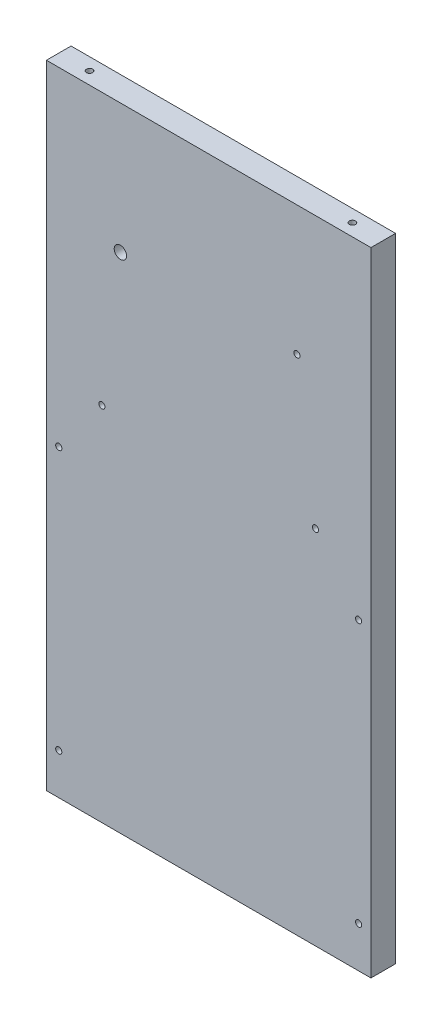
from build123d import *
from OCP.BRepAlgoAPI import BRepAlgoAPI_Cut
from OCP.TopTools import TopTools_ListOfShape

# Parameters (mm, degrees)
SKETCH1_W           = 158
SKETCH1_H           = 308
SKETCH1_R           = 1.5
SKETCH1_R_2         = 3
BOSS_EXTRUDE1_DEPTH = 12
SKETCH5_R           = 3
CUT_EXTRUDE4_DEPTH  = 3
CUT_EXTRUDE4_TAPER  = 45
CUT_EXTRUDE5_START  = 103.536585
SKETCH6_R           = 1.5
CUT_EXTRUDE5_DEPTH  = 20


with BuildPart() as part:
    # Sketch1 → Boss-Extrude1 (new body)
    with BuildSketch(Plane.XY):
        with Locations((-77.951219512, -50.463414634)):
            Rectangle(SKETCH1_W, SKETCH1_H)
        with Locations((-129.951219512, -28.463414634)):
            Circle(SKETCH1_R, mode=Mode.SUBTRACT)
        with Locations((-25.951219512, -28.463414634)):
            Circle(SKETCH1_R, mode=Mode.SUBTRACT)
        with Locations((-34.951219512, 40.536585366)):
            Circle(SKETCH1_R, mode=Mode.SUBTRACT)
        with Locations((-4.951219512, -184.463414634)):
            Circle(SKETCH1_R, mode=Mode.SUBTRACT)
        with Locations((-4.951219512, -56.463414634)):
            Circle(SKETCH1_R, mode=Mode.SUBTRACT)
        with Locations((-150.951219512, -184.463414634)):
            Circle(SKETCH1_R, mode=Mode.SUBTRACT)
        with Locations((-150.951219512, -56.463414634)):
            Circle(SKETCH1_R, mode=Mode.SUBTRACT)
        with Locations((-120.951219512, 40.536585366)):
            Circle(SKETCH1_R_2, mode=Mode.SUBTRACT)
    extrude(amount=BOSS_EXTRUDE1_DEPTH)

    # Sketch5 → Cut-Extrude4 (cut)
    with BuildSketch(Plane.XY):
        with Locations((-25.951219512, -28.463414634)):
            Circle(SKETCH5_R)
        with Locations((-129.951219512, -28.463414634)):
            Circle(SKETCH5_R)
        with Locations((-34.951219512, 40.536585366)):
            Circle(SKETCH5_R)
        with Locations((-4.951219512, -56.463414634)):
            Circle(SKETCH5_R)
        with Locations((-4.951219512, -184.463414634)):
            Circle(SKETCH5_R)
        with Locations((-150.951219512, -56.463414634)):
            Circle(SKETCH5_R)
        with Locations((-150.951219512, -184.463414634)):
            Circle(SKETCH5_R)
    extrude(amount=CUT_EXTRUDE4_DEPTH, taper=CUT_EXTRUDE4_TAPER, mode=Mode.SUBTRACT)


with BuildPart() as cut_extrude5_tool:
    # Sketch6 → Cut-Extrude5 (new body)
    with BuildSketch(Plane(origin=(0, 0, 0), x_dir=(1, 0, 0), z_dir=(0, 1, 0)).offset(CUT_EXTRUDE5_START)):
        with Locations(Location((-141.951219512, -6, 0), (0, 0, 90))):
            Circle(SKETCH6_R)
        with Locations(Location((-13.951219512, -6, 0), (0, 0, 90))):
            Circle(SKETCH6_R)
    extrude(amount=-CUT_EXTRUDE5_DEPTH)


with BuildPart() as part_1:
    add(part.part)

    # Cut-Extrude5: cut by cut_extrude5_tool, with a tolerance
    cut_extrude5_stock = TopTools_ListOfShape()
    cut_extrude5_stock.Append(part_1.part.wrapped)
    cut_extrude5_tools = TopTools_ListOfShape()
    cut_extrude5_tools.Append(cut_extrude5_tool.part.wrapped)
    cut_extrude5_cut = BRepAlgoAPI_Cut()
    cut_extrude5_cut.SetArguments(cut_extrude5_stock)
    cut_extrude5_cut.SetTools(cut_extrude5_tools)
    cut_extrude5_cut.SetFuzzyValue(0.00001)
    cut_extrude5_cut.Build()
    add(Compound.cast(cut_extrude5_cut.Shape()).solids(), mode=Mode.REPLACE)


solid = part_1.part
